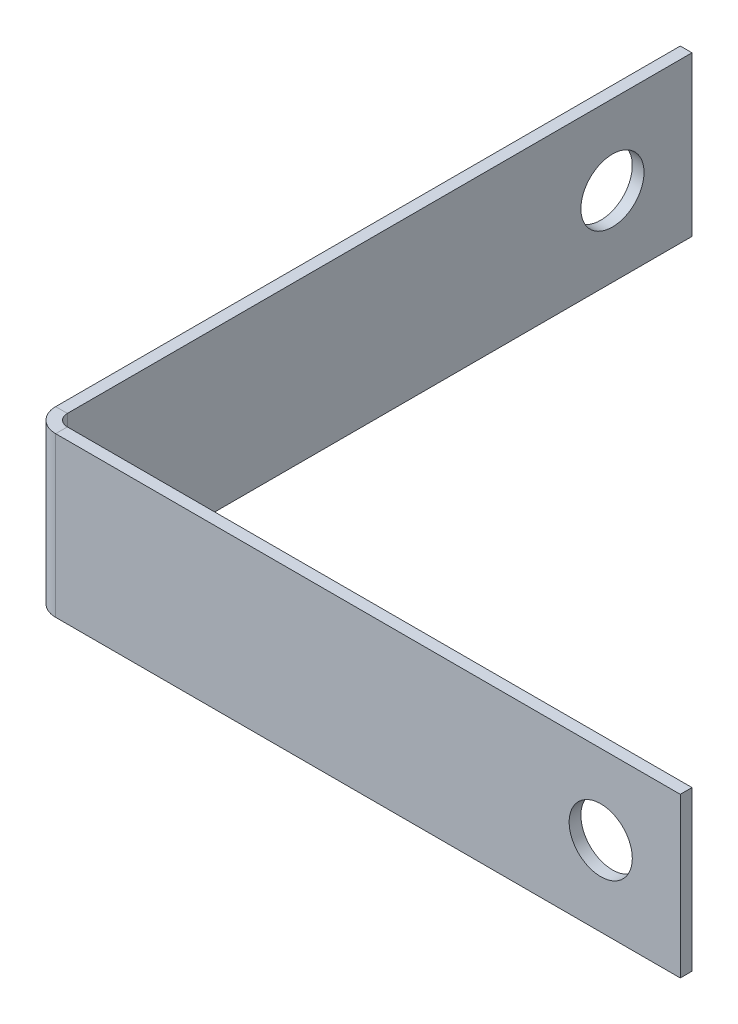
from build123d import *

# Parameters (mm, degrees)
BASE_FLANGE1_DEPTH = 10
SKETCH6_R          = 1.984375
CUT_EXTRUDE1_DEPTH = 10
SKETCH7_R          = 1.984375
CUT_EXTRUDE2_DEPTH = 10


# Sheet-metal steps are written as plain solids
with BuildPart() as part:
    # Sketch1 → Base-Flange1 (new body)
    with BuildSketch(Plane(origin=(0, 0, 0), x_dir=(1, 0, 0), z_dir=(0, 1, 0))):
        with BuildLine():
            Line((0, 40), (0, 0.7366))
            ThreePointArc((0, 0.7366), (0.215745145, 0.215745145), (0.7366, 0))
            Line((0.7366, 0), (40, 0))
            Line((40, 0), (40, -0.7366))
            Line((40, -0.7366), (0.7366, -0.7366))
            ThreePointArc((0.7366, -0.7366), (-0.30510971, -0.30510971), (-0.7366, 0.7366))
            Line((-0.7366, 0.7366), (-0.7366, 40))
            Line((-0.7366, 40), (0, 40))
        make_face()
    extrude(amount=BASE_FLANGE1_DEPTH)

    # Sketch6 → Cut-Extrude1 (cut)
    with BuildSketch(Plane.XY.offset(0.7366)):
        with Locations((35, 5)):
            Circle(SKETCH6_R)
    extrude(amount=-CUT_EXTRUDE1_DEPTH, mode=Mode.SUBTRACT)

    # Sketch7 → Cut-Extrude2 (cut)
    with BuildSketch(Plane.ZY.offset(0.7366)):
        with Locations((-35, 5)):
            Circle(SKETCH7_R)
    extrude(amount=-CUT_EXTRUDE2_DEPTH, mode=Mode.SUBTRACT)


solid = part.part
